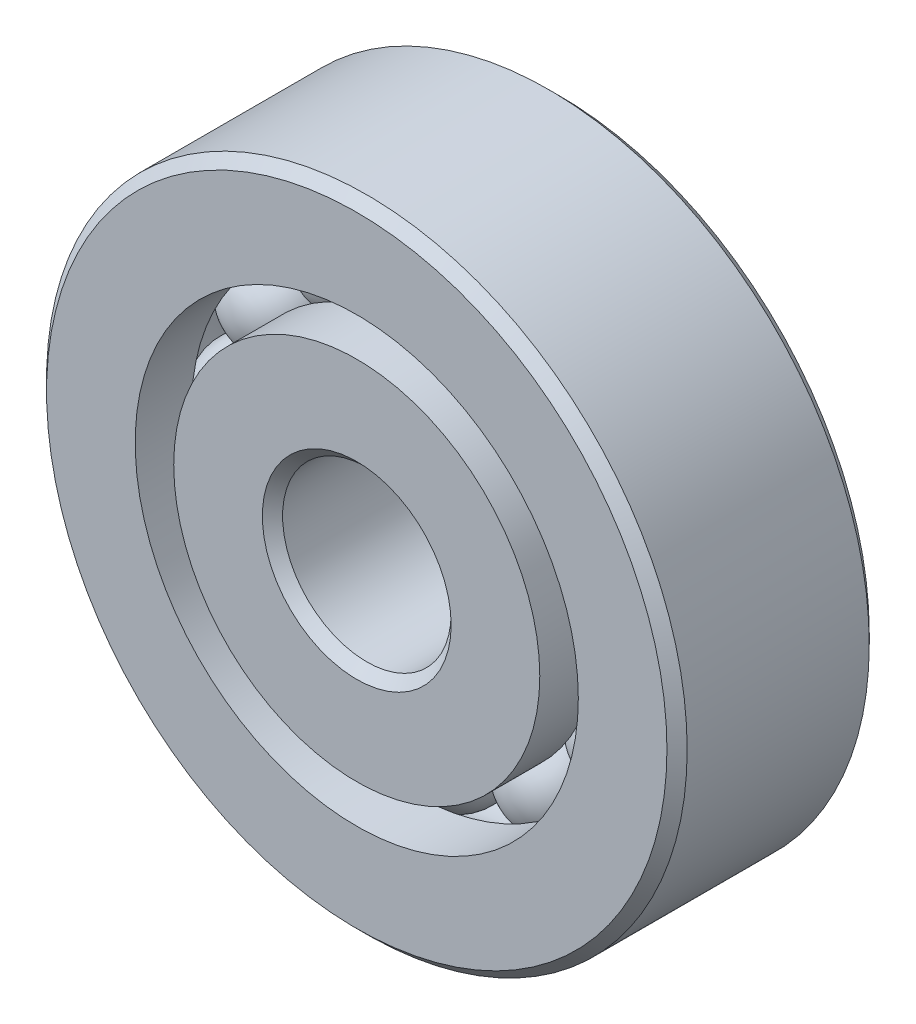
from build123d import *

# Parameters (mm, degrees)
CIRPATTERN1_COUNT = 12


with BuildPart() as part:
    # Sketch1 → Revolve1 (revolve)
    with BuildSketch(Plane(origin=(0, 0, 0), x_dir=(0, 0, -1), z_dir=(1, 0, 0))):
        with BuildLine():
            Line((2.7, 9.5), (-2.7, 9.5))
            Line((-2.7, 9.5), (-3, 9.2))
            Line((-3, 9.2), (-3, 6.571428571))
            Line((-3, 6.571428571), (-1.333333333, 6.571428571))
            ThreePointArc((-1.333333333, 6.571428571), (0, 7.450623449), (1.333333333, 6.571428571))
            Line((1.333333333, 6.571428571), (3, 6.571428571))
            Line((3, 6.571428571), (3, 9.2))
            Line((3, 9.2), (2.7, 9.5))
        make_face()
    revolve(axis=Axis((0, 0, 3), (0, 0, -1)))


with BuildPart() as body_2:
    # Sketch3 → Revolve3 (revolve)
    with BuildSketch(Plane(origin=(0, 0, 0), x_dir=(0, 0, -1), z_dir=(1, 0, 0))):
        with BuildLine():
            Line((-3, 5.428571429), (-1.333333333, 5.428571429))
            ThreePointArc((-1.333333333, 5.428571429), (0, 4.549376551), (1.333333333, 5.428571429))
            Line((1.333333333, 5.428571429), (3, 5.428571429))
            Line((3, 5.428571429), (3, 2.8))
            Line((3, 2.8), (2.7, 2.5))
            Line((2.7, 2.5), (-2.7, 2.5))
            Line((-2.7, 2.5), (-3, 2.8))
            Line((-3, 2.8), (-3, 5.428571429))
        make_face()
    revolve(axis=Axis((0, 0, 3), (0, 0, -1)))


with BuildPart() as body_3:
    # Sketch4 → Revolve4 (revolve)
    with BuildSketch(Plane(origin=(0, 0, 0), x_dir=(0, 0, -1), z_dir=(1, 0, 0))):
        with BuildLine():
            Line((-1.450623449, 6), (1.450623449, 6))
            ThreePointArc((1.450623449, 6), (0, 7.450623449), (-1.450623449, 6))
        make_face()
    revolve(axis=Axis((0, 6, 1.450623449), (0, 0, -1)))


with BuildPart() as cirpattern1_1:
    # CirPattern1: pattern copy
    add(body_3.part.rotate(Axis((0, 0, -3), (0, 0, 1)), 1 * 360 / CIRPATTERN1_COUNT))


with BuildPart() as cirpattern1_2:
    # CirPattern1: pattern copy
    add(body_3.part.rotate(Axis((0, 0, -3), (0, 0, 1)), 2 * 360 / CIRPATTERN1_COUNT))


with BuildPart() as cirpattern1_3:
    # CirPattern1: pattern copy
    add(body_3.part.rotate(Axis((0, 0, -3), (0, 0, 1)), 3 * 360 / CIRPATTERN1_COUNT))


with BuildPart() as cirpattern1_4:
    # CirPattern1: pattern copy
    add(body_3.part.rotate(Axis((0, 0, -3), (0, 0, 1)), 4 * 360 / CIRPATTERN1_COUNT))


with BuildPart() as cirpattern1_5:
    # CirPattern1: pattern copy
    add(body_3.part.rotate(Axis((0, 0, -3), (0, 0, 1)), 5 * 360 / CIRPATTERN1_COUNT))


with BuildPart() as cirpattern1_6:
    # CirPattern1: pattern copy
    add(body_3.part.rotate(Axis((0, 0, -3), (0, 0, 1)), 6 * 360 / CIRPATTERN1_COUNT))


with BuildPart() as cirpattern1_7:
    # CirPattern1: pattern copy
    add(body_3.part.rotate(Axis((0, 0, -3), (0, 0, 1)), 7 * 360 / CIRPATTERN1_COUNT))


with BuildPart() as cirpattern1_8:
    # CirPattern1: pattern copy
    add(body_3.part.rotate(Axis((0, 0, -3), (0, 0, 1)), 8 * 360 / CIRPATTERN1_COUNT))


with BuildPart() as cirpattern1_9:
    # CirPattern1: pattern copy
    add(body_3.part.rotate(Axis((0, 0, -3), (0, 0, 1)), 9 * 360 / CIRPATTERN1_COUNT))


with BuildPart() as cirpattern1_10:
    # CirPattern1: pattern copy
    add(body_3.part.rotate(Axis((0, 0, -3), (0, 0, 1)), 10 * 360 / CIRPATTERN1_COUNT))


with BuildPart() as cirpattern1_11:
    # CirPattern1: pattern copy
    add(body_3.part.rotate(Axis((0, 0, -3), (0, 0, 1)), 11 * 360 / CIRPATTERN1_COUNT))


solid = Compound([part.part, body_2.part, body_3.part, cirpattern1_1.part, cirpattern1_2.part, cirpattern1_3.part, cirpattern1_4.part, cirpattern1_5.part, cirpattern1_6.part, cirpattern1_7.part, cirpattern1_8.part, cirpattern1_9.part, cirpattern1_10.part, cirpattern1_11.part])
